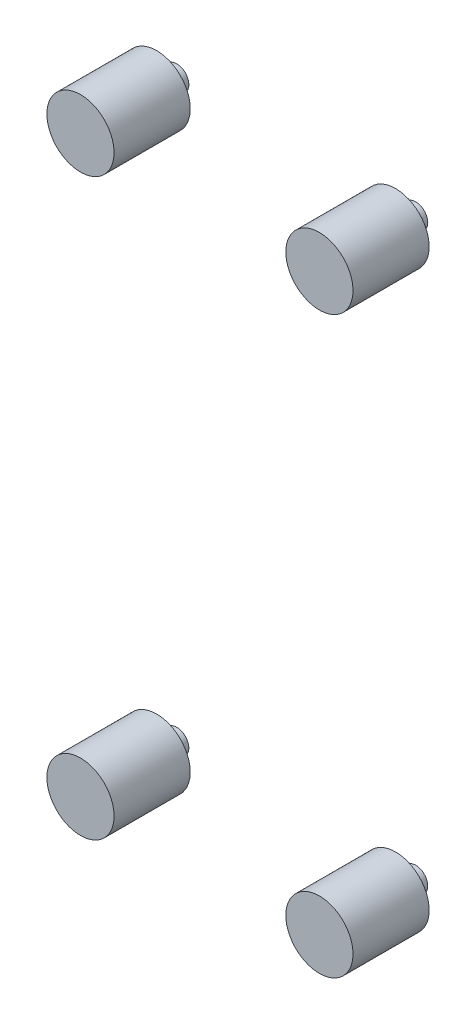
from build123d import *

# Parameters (mm, degrees)
SKETCH1_R             = 3
BOSS_EXTRUDE1_DEPTH   = 6.8
BOSS_EXTRUDE1_2_DEPTH = 6.8
BOSS_EXTRUDE1_3_DEPTH = 6.8
BOSS_EXTRUDE1_4_DEPTH = 6.8
SKETCH2_R             = 1.075
BOSS_EXTRUDE2_DEPTH   = 1.8


with BuildPart() as part:
    # Sketch1 → Boss-Extrude1 (new body)
    with BuildSketch(Plane(origin=(0, 0, 8.5), x_dir=(-1, 0, 0), z_dir=(0, 0, -1))):
        with Locations((-10.453037774, 25.682707052)):
            Circle(SKETCH1_R)
    extrude(amount=BOSS_EXTRUDE1_DEPTH)


with BuildPart() as body_2:
    # Sketch1 → Boss-Extrude1 2 (new body)
    with BuildSketch(Plane(origin=(0, 0, 8.5), x_dir=(-1, 0, 0), z_dir=(0, 0, -1))):
        with Locations((10.882962226, 25.682707052)):
            Circle(SKETCH1_R)
    extrude(amount=BOSS_EXTRUDE1_2_DEPTH)


with BuildPart() as body_3:
    # Sketch1 → Boss-Extrude1 3 (new body)
    with BuildSketch(Plane(origin=(0, 0, 8.5), x_dir=(-1, 0, 0), z_dir=(0, 0, -1))):
        with Locations((-10.453037774, -25.625292948)):
            Circle(SKETCH1_R)
    extrude(amount=BOSS_EXTRUDE1_3_DEPTH)

    # Sketch2 → Boss-Extrude2 (add)
    with BuildSketch(Plane(origin=(0, 0, 1.7), x_dir=(-1, 0, 0), z_dir=(0, 0, -1))):
        with Locations((10.882962226, 25.682707052)):
            Circle(SKETCH2_R)
        with Locations((-10.453037774, 25.682707052)):
            Circle(SKETCH2_R)
        with Locations((-10.453037774, -25.625292948)):
            Circle(SKETCH2_R)
        with Locations((10.882962226, -25.625292948)):
            Circle(SKETCH2_R)
    extrude(amount=BOSS_EXTRUDE2_DEPTH)


with BuildPart() as body_4:
    # Sketch1 → Boss-Extrude1 4 (new body)
    with BuildSketch(Plane(origin=(0, 0, 8.5), x_dir=(-1, 0, 0), z_dir=(0, 0, -1))):
        with Locations((10.882962226, -25.625292948)):
            Circle(SKETCH1_R)
    extrude(amount=BOSS_EXTRUDE1_4_DEPTH)


with BuildPart() as boss_extrude2_piece_1:
    # of the separate pieces the step leaves, piece 1, a body of its own (boss_extrude2_pieces)
    add(body_3.part.solids().sort_by_distance((7.453037774, -25.625292948, 8.5))[0])


with BuildPart() as boss_extrude2_piece_2:
    # of the separate pieces the step leaves, piece 2, a body of its own (boss_extrude2_pieces)
    add(body_3.part.solids().sort_by_distance((9.378037774, 25.682707052, 1.7))[0])


with BuildPart() as boss_extrude2_piece_3:
    # of the separate pieces the step leaves, piece 3, a body of its own (boss_extrude2_pieces)
    add(body_3.part.solids().sort_by_distance((-11.957962226, 25.682707052, 1.7))[0])


with BuildPart() as boss_extrude2_piece_4:
    # of the separate pieces the step leaves, piece 4, a body of its own (boss_extrude2_pieces)
    add(body_3.part.solids().sort_by_distance((-11.957962226, -25.625292948, 1.7))[0])


solid = Compound([part.part, body_2.part, body_4.part, boss_extrude2_piece_1.part, boss_extrude2_piece_2.part, boss_extrude2_piece_3.part, boss_extrude2_piece_4.part])
